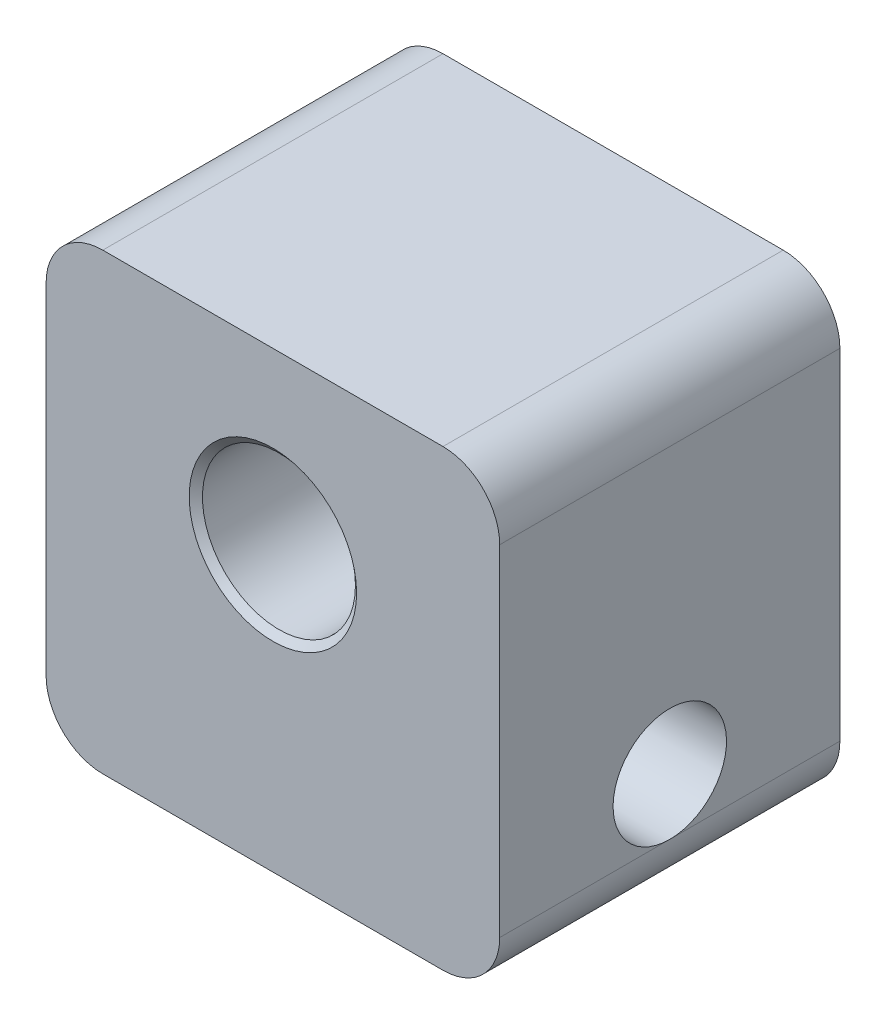
from build123d import *

# Parameters (mm, degrees)
SKETCH1_W                         = 40
SKETCH1_H                         = 30
BOSS_EXTRUDE1_DEPTH               = 40
F_1_2_CLEARANCE_HOLE1_D           = 13.49248
F_1_2_CLEARANCE_HOLE1_CSINK_D     = 14.76248
F_1_2_CLEARANCE_HOLE1_CSINK_ANGLE = 100
CUT_EXTRUDE1_REACH                = 60.523
SKETCH4_R                         = 5
FILLET1_R                         = 5


with BuildPart() as part:
    # Sketch1 → Boss-Extrude1 (new body)
    with BuildSketch(Plane(origin=(0, 0, 0), x_dir=(1, 0, 0), z_dir=(0, 1, 0))):
        Rectangle(SKETCH1_W, SKETCH1_H)
    extrude(amount=BOSS_EXTRUDE1_DEPTH)

    # 1/2 Clearance Hole1 (through all)
    with Locations(Plane.XY.offset(15)):
        with Locations((0, 25)):
            CounterSinkHole(F_1_2_CLEARANCE_HOLE1_D / 2, F_1_2_CLEARANCE_HOLE1_CSINK_D / 2, counter_sink_angle=F_1_2_CLEARANCE_HOLE1_CSINK_ANGLE)

    # Sketch4 → Cut-Extrude1 (cut, up to next)
    with BuildSketch(Plane(origin=(20, 0, 0), x_dir=(0, 0, -1), z_dir=(1, 0, 0)), mode=Mode.PRIVATE) as cut_extrude1_sk1:
        with Locations((0, 10)):
            Circle(SKETCH4_R)
    cut_extrude1_tool1 = extrude(cut_extrude1_sk1.sketch, amount=-CUT_EXTRUDE1_REACH, mode=Mode.PRIVATE) & part.part
    add(cut_extrude1_tool1.solids().sort_by_distance((20, 10, 0))[0], mode=Mode.SUBTRACT)

    # Fillet1
    fillet1_edges = [part.edges().sort_by_distance(p)[0] for p in [
        (-20, 40, 0),
        (6.74624, 25, -15),
        (20, 40, 0),
        (-20, 0, 0),
        (20, 0, 0),
    ]]
    fillet(fillet1_edges, radius=FILLET1_R - 0.0001)  # a hair under: the kernel refuses the full size


solid = part.part
